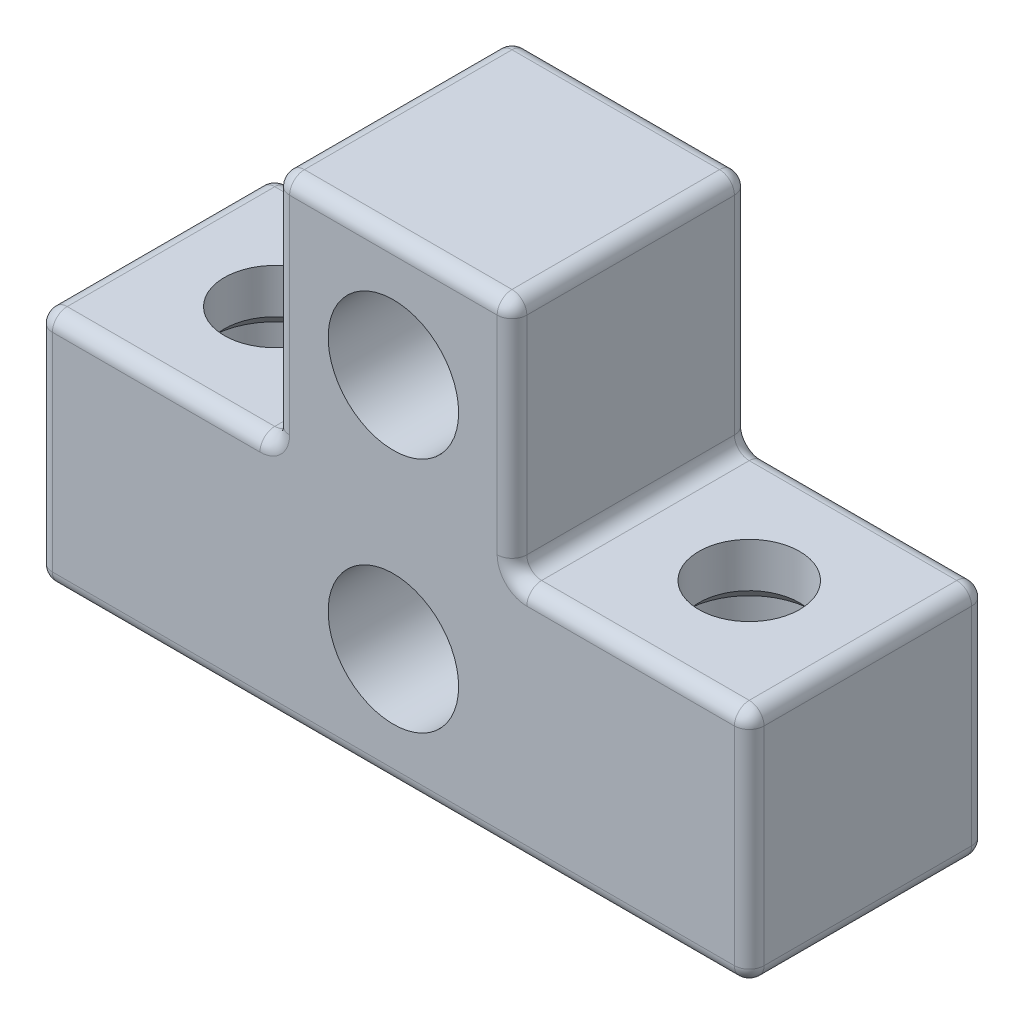
from build123d import *

# Parameters (mm, degrees)
BOSS_EXTRUDE1_DEPTH                      = 8
F_4_4_4_4_DIAMETER_HOLE1_D               = 4.4
F_4_4_4_4_DIAMETER_HOLE1_DEPTH           = 6
F_4_4_4_4_DIAMETER_HOLE1_TIP             = 2.2
F_4_4_4_4_DIAMETER_HOLE1_ON_FACE_2_D     = 4.4
F_4_4_4_4_DIAMETER_HOLE1_ON_FACE_2_DEPTH = 6
F_4_4_4_4_DIAMETER_HOLE1_ON_FACE_2_TIP   = 2.2
F_3_4_START                              = 6.4999999
F_3_4_3_4_DIAMETER_HOLE1_OUTLINE_R       = 1.7
F_3_4_3_4_DIAMETER_HOLE1_DEPTH           = 1.5000001
F_3_4_3_4_DIAMETER_HOLE1_2_OUTLINE_R     = 1.7
F_3_4_3_4_DIAMETER_HOLE1_2_DEPTH         = 1.5000001
FILLET1_R                                = 0.5


# Read off the part's stored shape, not the designer's step: Ø3.4 (3.4) Diameter Hole1
with BuildPart() as part:
    # Sketch1 → Boss-Extrude1 (new body)
    with BuildSketch(Plane.XY):
        Polygon((-12, 0), (12, 0), (12, 8), (4, 8), (4, 16), (-4, 16), (-4, 8), (-12, 8), align=None)
    extrude(amount=BOSS_EXTRUDE1_DEPTH)

    # Ø4.4 (4.4) Diameter Hole1
    with Locations(Plane(origin=(0, 4, 8), x_dir=(1, 0, 0), z_dir=(0, 0, 1))):
        with Locations((0, 0), (0, 8)):
            Hole(F_4_4_4_4_DIAMETER_HOLE1_D / 2, depth=F_4_4_4_4_DIAMETER_HOLE1_DEPTH)
            with Locations((0, 0, -(F_4_4_4_4_DIAMETER_HOLE1_DEPTH + F_4_4_4_4_DIAMETER_HOLE1_TIP / 2))):  # 90° drill point
                Cone(0, F_4_4_4_4_DIAMETER_HOLE1_D / 2, F_4_4_4_4_DIAMETER_HOLE1_TIP, mode=Mode.SUBTRACT)

    # Ø4.4 (4.4) Diameter Hole1 on face 2
    with Locations(Plane(origin=(8, 0, 4), x_dir=(0, 0, -1), z_dir=(0, -1, 0))):
        with Locations((0, 0), (0, -16)):
            Hole(F_4_4_4_4_DIAMETER_HOLE1_ON_FACE_2_D / 2, depth=F_4_4_4_4_DIAMETER_HOLE1_ON_FACE_2_DEPTH)
            with Locations((0, 0, -(F_4_4_4_4_DIAMETER_HOLE1_ON_FACE_2_DEPTH + F_4_4_4_4_DIAMETER_HOLE1_ON_FACE_2_TIP / 2))):  # 90° drill point
                Cone(0, F_4_4_4_4_DIAMETER_HOLE1_ON_FACE_2_D / 2, F_4_4_4_4_DIAMETER_HOLE1_ON_FACE_2_TIP, mode=Mode.SUBTRACT)

    # Ø3.4 (3.4) Diameter Hole1 outline → Ø3.4 (3.4) Diameter Hole1 (cut)
    with BuildSketch(Plane(origin=(0, 0, 0), x_dir=(1, 0, 0), z_dir=(0, 1, 0)).offset(F_3_4_START)):
        with Locations((-8, -4)):
            Circle(F_3_4_3_4_DIAMETER_HOLE1_OUTLINE_R)
        with Locations((8, -4)):
            Circle(F_3_4_3_4_DIAMETER_HOLE1_OUTLINE_R)
    extrude(amount=F_3_4_3_4_DIAMETER_HOLE1_DEPTH, mode=Mode.SUBTRACT)

    # 3.4 _3.4_ Diameter Hole1 2 outline → 3.4 _3.4_ Diameter Hole1 2 (cut)
    with BuildSketch(Plane.XY):
        with Locations((0, 4)):
            Circle(F_3_4_3_4_DIAMETER_HOLE1_2_OUTLINE_R)
        with Locations((0, 12)):
            Circle(F_3_4_3_4_DIAMETER_HOLE1_2_OUTLINE_R)
    extrude(amount=F_3_4_3_4_DIAMETER_HOLE1_2_DEPTH, mode=Mode.SUBTRACT)

    # Fillet1
    fillet1_edges = [part.edges().sort_by_distance(p)[0] for p in [
        (8, 8, 0),
        (12, 4, 0),
        (0, 0, 0),
        (-12, 4, 0),
        (12, 4, 8),
        (-12, 8, 4),
        (-4, 8, 4),
        (-4, 16, 4),
        (4, 16, 4),
        (4, 8, 4),
        (12, 8, 4),
        (12, 0, 4),
        (-12, 0, 4),
        (8, 8, 8),
        (4, 12, 8),
        (0, 16, 8),
        (-4, 12, 8),
        (-8, 8, 8),
        (-12, 4, 8),
        (-8, 8, 0),
        (0, 0, 8),
        (-4, 12, 0),
        (0, 16, 0),
        (4, 12, 0),
    ]]
    fillet(fillet1_edges, radius=FILLET1_R)


solid = part.part
